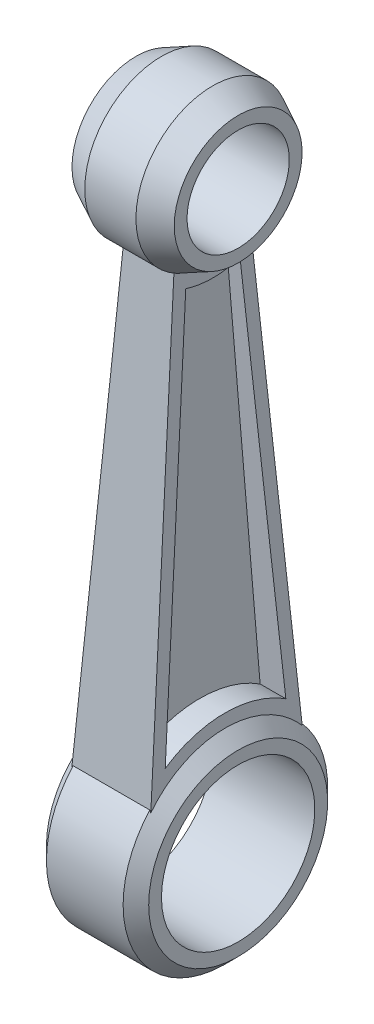
from build123d import *

# Parameters (mm, degrees)
BOSS_EXTRU_1_DEPTH      = 2.0000001
BOSS_EXTRU_1_START      = 2.0000001
BOSS_EXTRU_1_2_DEPTH    = 1.088880676
BOSS_EXTRU_1_START_2    = 3.256370695
BOSS_EXTRU_1_3_DEPTH    = 1.743629305
BOSS_EXTRU_1_START_3    = 3.172268194
BOSS_EXTRU_1_4_DEPTH    = 0.084102501
ENL_V_MAT_EXTRU_1_DEPTH = 9


with BuildPart() as part:
    # Esquisse5 → Révolution4 (revolve)
    with BuildSketch(Plane.XY, mode=Mode.PRIVATE) as r_volution4_sk:
        Polygon((0, 51), (2.4e-16, 48.99999999999999), (4, 48.99999999999999), (4, 49.99999999999999), (2, 51), align=None)
    revolve(r_volution4_sk.sketch.rotate(Axis((0, 45, 0), (1, 0, 0)), 90), axis=Axis((0, 45, 0), (1, 0, 0)))



with BuildPart() as body_2:
    # Esquisse1 → Révolution5 (revolve)
    with BuildSketch(Plane.XY, mode=Mode.PRIVATE) as r_volution5_sk:
        Polygon((0, 8), (2.4e-16, 6), (4, 6), (4, 7), (3, 8), align=None)
    revolve(r_volution5_sk.sketch.rotate(Axis((0, 0, 0), (1, 0, 0)), 90), axis=Axis((0, 0, 0), (1, 0, 0)))


with BuildPart() as part_1:
    add(part.part)

    add(body_2.part)  # Boss.-Extru.1 merges body 2
    # Boss.-Extru.1: read off the stored shape, not the designer's step
    # Boss.-Extru.1 outline → Boss.-Extru.1 (add)
    with BuildSketch(Plane(origin=(0, 0, 0), x_dir=(0, 0, -1), z_dir=(1, 0, 0))):
        with BuildLine():
            Line((5.910337632, 5.39146632), (3, 39.803847577))
            ThreePointArc((3, 39.803847577), (0, 39), (-3, 39.803847577))
            Line((-3, 39.803847577), (-5.910337632, 5.39146632))
            ThreePointArc((-5.910337632, 5.39146632), (0, 8), (5.910337632, 5.39146632))
        make_face()
    extrude(amount=BOSS_EXTRU_1_DEPTH)

    # Boss.-Extru.1 2 outline → Boss.-Extru.1 2 (add)
    with BuildSketch(Plane.YZ.offset(BOSS_EXTRU_1_START)):
        with BuildLine():
            Line((5.39146632, -5.910337632), (39.803847577, -3))
            ThreePointArc((39.803847577, -3), (39, 0), (39.803847577, 3))
            Line((39.803847577, 3), (5.39146632, 5.910337632))
            ThreePointArc((5.39146632, 5.910337632), (8, 0), (5.39146632, -5.910337632))
        make_face()
    extrude(amount=BOSS_EXTRU_1_2_DEPTH)

    # Boss.-Extru.1 3 outline → Boss.-Extru.1 3 (cut)
    with BuildSketch(Plane(origin=(0, 0, 0), x_dir=(-0.03224129401095809, 0.9994801143396995, 0), z_dir=(0.9994801143396996, 0.03224129401095809, 0)).offset(BOSS_EXTRU_1_START_2)):
        with BuildLine():
            add(Edge.make_bspline(
                [(39.719507575, -3), (39.40876316904248, -2.4620547166991815), (39.162117173894806, -1.8742292038543285), (38.995705810616926, -1.2534964190781621), (38.915241871226364, -0.6211657082460549), (38.915241871226335, 0.6211657082460427), (38.995705810617025, 1.2534964190781435), (39.16211717389472, 1.87422920385429), (39.408763169042494, 2.4620547166991438), (39.719507575, 3)],
                knots=[2.6179938779914917, 2.6179938779914917, 2.6179938779914917, 2.6179938779914917, 2.6179938779914917, 2.6179938779914917, 3.141592653589793, 3.141592653589793, 3.141592653589793, 3.141592653589793, 3.6651914291880856, 3.6651914291880856, 3.6651914291880856, 3.6651914291880856, 3.6651914291880856, 3.6651914291880856], degree=5, weights=[1, 0.9999999999999999, 0.9995355802743661, 0.9995355802743694, 0.9999999999999987, 0.9999999999999997, 0.9995355802743684, 0.9995355802743646, 1.000000000000001, 1]))
            Line((39.719507575, 3), (5.142379796, 5.922750354))
            add(Edge.make_bspline(
                [(5.142379796, 5.922750354), (12.176597342754391, 2.94e-15), (5.142379796, -5.922750354)],
                knots=[5.4127279348930895, 5.4127279348930895, 5.4127279348930895, 7.153642679466082, 7.153642679466082, 7.153642679466082], degree=2, weights=[1, 0.6444768969331859, 1]))
            Line((5.142379796, -5.922750354), (39.719507575, -3))
        make_face()
    extrude(amount=BOSS_EXTRU_1_3_DEPTH, mode=Mode.SUBTRACT)

    # Boss.-Extru.1 4 outline → Boss.-Extru.1 4 (add)
    with BuildSketch(Plane(origin=(0, 0, 0), x_dir=(-0.03224129401095809, 0.9994801143396995, 0), z_dir=(0.9994801143396996, 0.03224129401095809, 0)).offset(BOSS_EXTRU_1_START_3)):
        with BuildLine():
            add(Edge.make_bspline(
                [(39.719507575, -3), (39.40876316904248, -2.4620547166991815), (39.162117173894806, -1.8742292038543285), (38.995705810616926, -1.2534964190781621), (38.915241871226364, -0.6211657082460549), (38.915241871226335, 0.6211657082460427), (38.995705810617025, 1.2534964190781435), (39.16211717389472, 1.87422920385429), (39.408763169042494, 2.4620547166991438), (39.719507575, 3)],
                knots=[2.6179938779914917, 2.6179938779914917, 2.6179938779914917, 2.6179938779914917, 2.6179938779914917, 2.6179938779914917, 3.141592653589793, 3.141592653589793, 3.141592653589793, 3.141592653589793, 3.6651914291880856, 3.6651914291880856, 3.6651914291880856, 3.6651914291880856, 3.6651914291880856, 3.6651914291880856], degree=5, weights=[1, 0.9999999999999999, 0.9995355802743661, 0.9995355802743694, 0.9999999999999987, 0.9999999999999997, 0.9995355802743684, 0.9995355802743646, 1.000000000000001, 1]))
            Line((39.719507575, 3), (5.142379796, 5.922750354))
            add(Edge.make_bspline(
                [(5.142379796, 5.922750354), (12.176597342754391, 2.94e-15), (5.142379796, -5.922750354)],
                knots=[5.4127279348930895, 5.4127279348930895, 5.4127279348930895, 7.153642679466082, 7.153642679466082, 7.153642679466082], degree=2, weights=[1, 0.6444768969331859, 1]))
            Line((5.142379796, -5.922750354), (39.719507575, -3))
        make_face()
    extrude(amount=BOSS_EXTRU_1_4_DEPTH)

    # Esquisse9 → Enlèv. mat.-Extru.1 (cut)
    with BuildSketch(Plane.ZY.offset(-10)):
        with BuildLine():
            Line((4.718521323912527, 7.617327682628817), (2.1211518499967568, 38.329114389434075))
            ThreePointArc((2.1211518499967568, 38.329114389434075), (1.073266212558332, 38.08276792083852), (1.29e-15, 38))
            ThreePointArc((1.29e-15, 38), (-1.073266212558333, 38.08276792083852), (-2.121151849996758, 38.32911438943409))
            Line((-2.121151849996758, 38.32911438943409), (-4.7185213239117045, 7.617327682628745))
            add(Edge.make_bspline(
                [(-4.7185213239117045, 7.617327682628745), (-4.011984255343939, 8.07025795693203), (-3.261550361542695, 8.410740591888102), (-2.271196708651888, 8.702341470829108), (-2.0704598676815396, 8.75383204519997), (-1.6635130029960707, 8.84279289802945), (-1.4564460321419168, 8.880350619711342), (-0.8364313606849374, 8.969908948596252), (-0.00941084225722296, 9.029205401703821), (0.8182594148600882, 8.971660679545407), (1.6462652533968807, 8.85376903934497), (2.0556953800959636, 8.764949997544292), (2.8506904444171615, 8.532525136333405), (3.238639754796587, 8.388601680371801), (3.9952504696443545, 8.044777052176356), (4.365252036804484, 7.843793302383422), (4.718521323912527, 7.617327682628817)],
                knots=[0, 0, 0, 0, 0.2499999999999994, 0.2499999999999994, 0.31249999999999933, 0.31249999999999933, 0.37499999999999933, 0.37499999999999933, 0.49999999999999944, 0.6249999999999996, 0.6249999999999996, 0.7499999999999997, 0.7499999999999997, 0.8749999999999999, 0.8749999999999999, 1, 1, 1, 1], degree=3))
        make_face()
    extrude(amount=ENL_V_MAT_EXTRU_1_DEPTH, mode=Mode.SUBTRACT)

    # Symétrie1: part across face


with BuildPart() as part_2:
    add(part_1.part)
    add(part_1.part.mirror(Plane(origin=(0, 20.598769337, 0), x_dir=(0, 0, 1), z_dir=(-1, 0, 0))))


solid = part_2.part
